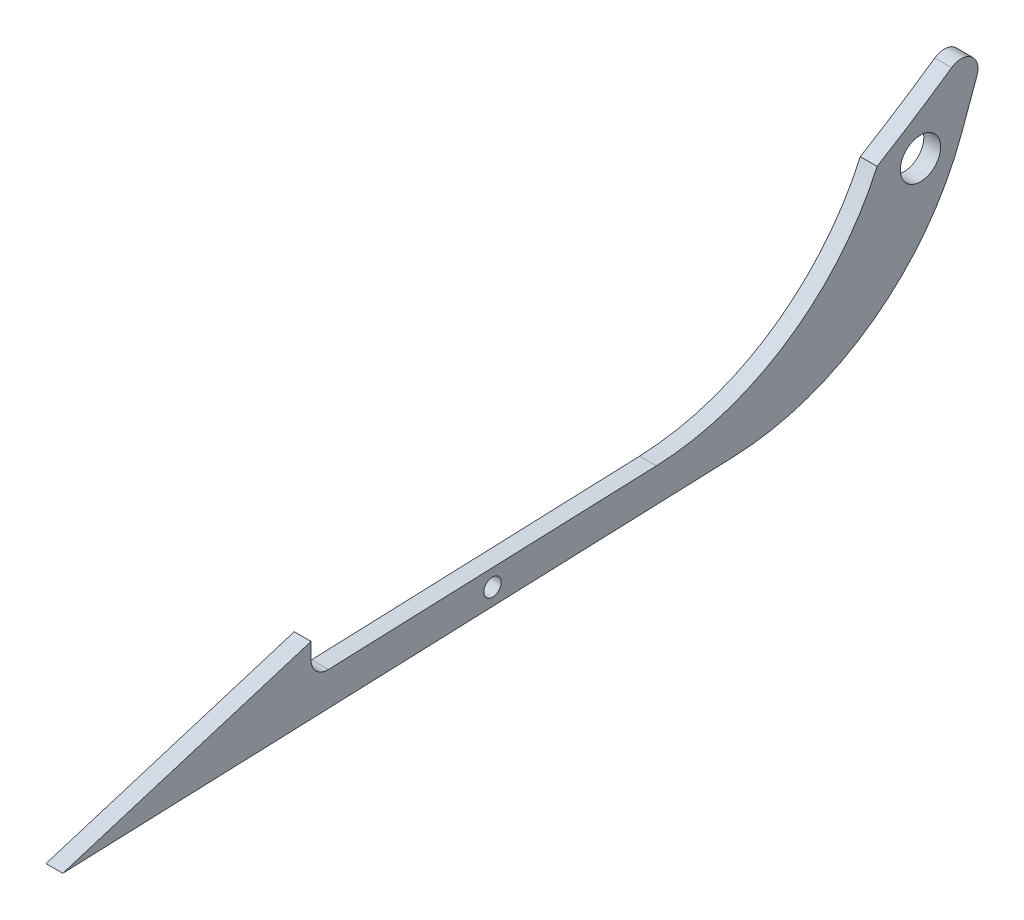
from build123d import *

# Parameters (mm, degrees)
SKETCH_1_R          = 6
EXTRUDE_1_DEPTH     = 5
FILLET_1_R          = 5
FILLET_2_R          = 75
FILLET_3_R          = 5
SKETCH_3_R          = 2.6
CUT_EXTRUDE_1_DEPTH = 160.415234704


with BuildPart() as part:
    # Эскиз1 → Бобышка-Вытянуть1 (new body)
    with BuildSketch(Plane(origin=(0, 0, 0), x_dir=(0, 0, -1), z_dir=(1, 0, 0))):
        with BuildLine():
            Line((126.237664014, 58.886284382), (98.821729218, -16.438377404))
            Line((98.821729218, -16.438377404), (-151.178270782, -25.884067346))
            Line((-151.178270782, -25.884067346), (-77.345590471, -3.080194644))
            Line((-77.345590471, -3.080194644), (-77.345590471, -13.087329783))
            Line((-77.345590471, -13.087329783), (75.539410437, -7.310912522))
            Line((75.539410437, -7.310912522), (90.975731778, 35.100031802))
            ThreePointArc((90.975731778, 35.100031802), (108.905022115, 46.550907327), (126.237664014, 58.886284382))
        make_face()
        with Locations((103.870185422, 30.698515365)):
            Circle(SKETCH_1_R, mode=Mode.SUBTRACT)
    extrude(amount=EXTRUDE_1_DEPTH)

    # Скругление1
    fillet_1_edges = [part.edges().sort_by_distance(p)[0] for p in [
        (2.5, -13.087329783, 77.345590471),
    ]]
    fillet(fillet_1_edges, radius=FILLET_1_R)

    # Скругление2
    # the kernel refuses this fillet: 75 mm, written as the material it adds along each edge
    with BuildSketch(Plane(origin=(0, -7.310912522, -75.539410437), x_dir=(0, -0.037755820465347284, 0.9992869948223027), z_dir=(1, 0, 0))) as fillet_2_piece_1:
        with BuildLine():
            CenterArc((50.223853574, -75), FILLET_2_R, 90, 63.724056715)
            Line((-17.026575163, -41.797894123), (0, 0))
            Line((0, 0), (50.223853574, 0))
        make_face()
    extrude(amount=5)
    # the kernel refuses this fillet: 75 mm, written as the material it takes off along each edge
    with BuildSketch(Plane(origin=(-126.080854452, -16.438377404, -98.821729218), x_dir=(0, -0.03775582046534733, 0.9992869948223025), z_dir=(1, 0, 0))) as fillet_2_2_piece_1:
        with BuildLine():
            CenterArc((FILLET_2_R * 0.672431223743, -FILLET_2_R), FILLET_2_R, 90, 67.836236553)
            Line((-FILLET_2_R * 0.253678140212, -FILLET_2_R * 0.622744852924), (0, 0))
            Line((0, 0), (FILLET_2_R * 0.672431223743, 0))
        make_face()
    extrude(amount=257.161708904, mode=Mode.SUBTRACT)

    # Скругление3
    fillet_3_edges = [part.edges().sort_by_distance(p)[0] for p in [
        (2.5, 58.886284382, -126.237664014),
    ]]
    fillet(fillet_3_edges, radius=FILLET_3_R)

    # Эскиз3 → Вырез-Вытянуть1 (cut, through all)
    with BuildSketch(Plane(origin=(5, 0, 0), x_dir=(0, 0, -1), z_dir=(1, 0, 0))):
        with Locations((-23.402722319, -16.052786924)):
            Circle(SKETCH_3_R)
    extrude(amount=-CUT_EXTRUDE_1_DEPTH, mode=Mode.SUBTRACT)


solid = part.part
